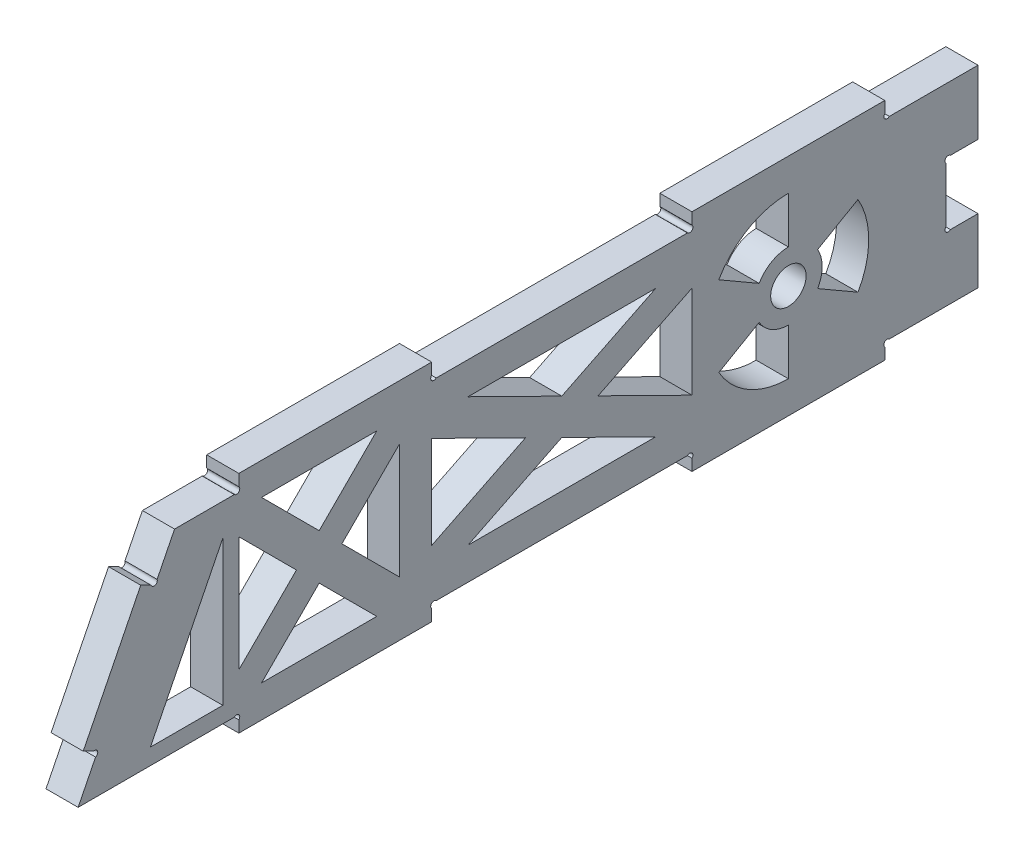
from build123d import *

# Parameters (mm, degrees)
SKETCH1_W               = 355.6
SKETCH1_H               = 76.2
BOSS_EXTRUDE1_DEPTH     = 12.7
CUT_EXTRUDE1_DEPTH      = 183.279291199
CUT_EXTRUDE1_DEPTH_BACK = 183.279291199
SKETCH3_W               = 76.2
SKETCH3_H               = 6.35
BOSS_EXTRUDE2_DEPTH     = 12.7
SKETCH4_W               = 12.7
SKETCH4_H               = 25.4
CUT_EXTRUDE2_DEPTH      = 184.711546997
SKETCH5_R               = 7
CUT_EXTRUDE3_DEPTH      = 184.711546997
CUT_EXTRUDE4_DEPTH      = 184.711546997
BOSS_EXTRUDE3_DEPTH     = 12.7
SKETCH9_R               = 1.27
CUT_EXTRUDE6_DEPTH      = 184.711546997
CUT_EXTRUDE7_DEPTH      = 184.711546997


with BuildPart() as part:
    # Sketch1 → Boss-Extrude1 (new body)
    with BuildSketch(Plane(origin=(0, 0, 0), x_dir=(0, 0, -1), z_dir=(1, 0, 0))):
        Rectangle(SKETCH1_W, SKETCH1_H)
    extrude(amount=BOSS_EXTRUDE1_DEPTH)

    # Sketch2 → Cut-Extrude1 (cut, two sides: drawn at the far end of the back side and taken through both)
    with BuildSketch(Plane(origin=(12.7, 0, 0), x_dir=(0, 0, -1), z_dir=(1, 0, 0)).offset(-CUT_EXTRUDE1_DEPTH_BACK)):
        Polygon((-507.550847217, -697.601694433), (-177.8, -38.1), (-139.7, 38.1), (190.050847217, 697.601694433), (-1128.95254165, 1357.103388866), (-1826.554236083, -38.1), align=None)
    extrude(amount=CUT_EXTRUDE1_DEPTH + CUT_EXTRUDE1_DEPTH_BACK, mode=Mode.SUBTRACT)

    # Sketch3 → Boss-Extrude2 (add)
    with BuildSketch(Plane.ZY):
        with Locations((-102.87, -41.275)):
            Rectangle(SKETCH3_W, SKETCH3_H)
        with Locations((76.2, -41.275)):
            Rectangle(SKETCH3_W, SKETCH3_H)
        with Locations((-102.87, 41.275)):
            Rectangle(SKETCH3_W, SKETCH3_H)
        with Locations((76.2, 41.275)):
            Rectangle(SKETCH3_W, SKETCH3_H)
    extrude(amount=-BOSS_EXTRUDE2_DEPTH)

    # Sketch4 → Cut-Extrude2 (cut, through all)
    with BuildSketch(Plane.ZY):
        with Locations((-171.45, 0)):
            Rectangle(SKETCH4_W, SKETCH4_H)
    extrude(amount=-CUT_EXTRUDE2_DEPTH, mode=Mode.SUBTRACT)

    # Sketch5 → Cut-Extrude3 (cut, through all)
    with BuildSketch(Plane.ZY):
        with Locations((-102.87, 0)):
            Circle(SKETCH5_R)
    extrude(amount=-CUT_EXTRUDE3_DEPTH, mode=Mode.SUBTRACT)

    # Sketch6 → Cut-Extrude4 (cut, through all)
    with BuildSketch(Plane.ZY):
        Polygon((23.758802297, 25.4), (-50.428802297, 25.4), (-13.335, 7.08207294), align=None)
        Polygon((-27.676197703, 0), (-64.77, 18.31792706), (-64.77, -18.31792706), align=None)
        Polygon((38.1, -18.31792706), (38.1, 18.31792706), (1.006197703, 0), align=None)
        Polygon((-13.335, -7.08207294), (-50.428802297, -25.4), (23.758802297, -25.4), align=None)
        Polygon((105.319743879, 31.75), (59.780256121, 31.75), (82.55, 8.980256121), align=None)
        Polygon((73.569743879, 0), (50.8, 22.769743879), (50.8, -22.769743879), align=None)
        Polygon((114.3, 22.769743879), (91.530256121, 0), (114.3, -22.769743879), align=None)
        Polygon((105.319743879, -31.75), (82.55, -8.980256121), (59.780256121, -31.75), align=None)
    extrude(amount=-CUT_EXTRUDE4_DEPTH, mode=Mode.SUBTRACT)

    # Sketch8 → Boss-Extrude3 (add)
    with BuildSketch(Plane(origin=(12.7, 0, 0), x_dir=(0, 0, -1), z_dir=(1, 0, 0))):
        Polygon((-147.390774674, 22.718450651), (-170.109225326, -22.718450651), (-175.788837989, -19.87864432), (-153.070387337, 25.558256983), align=None)
    extrude(amount=-BOSS_EXTRUDE3_DEPTH)

    # Sketch9 → Cut-Extrude6 (cut, through all)
    with BuildSketch(Plane.ZY):
        with Locations((-165.998025612, 11.801974388)):
            Circle(SKETCH9_R)
        with Locations((-165.998025612, -11.801974388)):
            Circle(SKETCH9_R)
        with Locations((-141.868025612, 38.998025612)):
            Circle(SKETCH9_R)
        with Locations((-141.868025612, -38.998025612)):
            Circle(SKETCH9_R)
        with Locations((-63.871974388, -38.998025612)):
            Circle(SKETCH9_R)
        with Locations((-63.871974388, 38.998025612)):
            Circle(SKETCH9_R)
        with Locations((37.201974388, 38.998025612)):
            Circle(SKETCH9_R)
        with Locations((37.201974388, -38.998025612)):
            Circle(SKETCH9_R)
        with Locations((115.198025612, -38.998025612)):
            Circle(SKETCH9_R)
        with Locations((115.198025612, 38.998025612)):
            Circle(SKETCH9_R)
        with Locations((147.792383937, 23.92327844)):
            Circle(SKETCH9_R)
        with Locations((171.314053114, -23.120059914)):
            Circle(SKETCH9_R)
    extrude(amount=-CUT_EXTRUDE6_DEPTH, mode=Mode.SUBTRACT)

    # Sketch10 → Cut-Extrude7 (cut, through all)
    with BuildSketch(Plane.ZY):
        with BuildLine():
            Line((-130.36630657, -15.875), (-114.431439141, -6.675))
            ThreePointArc((-114.431439141, -6.675), (-116.22, 0), (-114.431439141, 6.675))
            Line((-114.431439141, 6.675), (-130.36630657, 15.875))
            ThreePointArc((-130.36630657, 15.875), (-134.62, 0), (-130.36630657, -15.875))
        make_face()
        with BuildLine():
            ThreePointArc((-91.308560859, -6.675), (-96.195, -11.561439141), (-102.87, -13.35))
            Line((-102.87, -13.35), (-102.87, -31.75))
            ThreePointArc((-102.87, -31.75), (-86.995, -27.49630657), (-75.37369343, -15.875))
            Line((-75.37369343, -15.875), (-91.308560859, -6.675))
        make_face()
        with BuildLine():
            Line((-102.87, 31.75), (-102.87, 13.35))
            ThreePointArc((-102.87, 13.35), (-96.195, 11.561439141), (-91.308560859, 6.675))
            Line((-91.308560859, 6.675), (-75.37369343, 15.875))
            ThreePointArc((-75.37369343, 15.875), (-86.995, 27.49630657), (-102.87, 31.75))
        make_face()
        Polygon((120.65, 25.4), (120.65, -31.75), (149.225, -31.75), align=None)
    extrude(amount=-CUT_EXTRUDE7_DEPTH, mode=Mode.SUBTRACT)


solid = part.part
